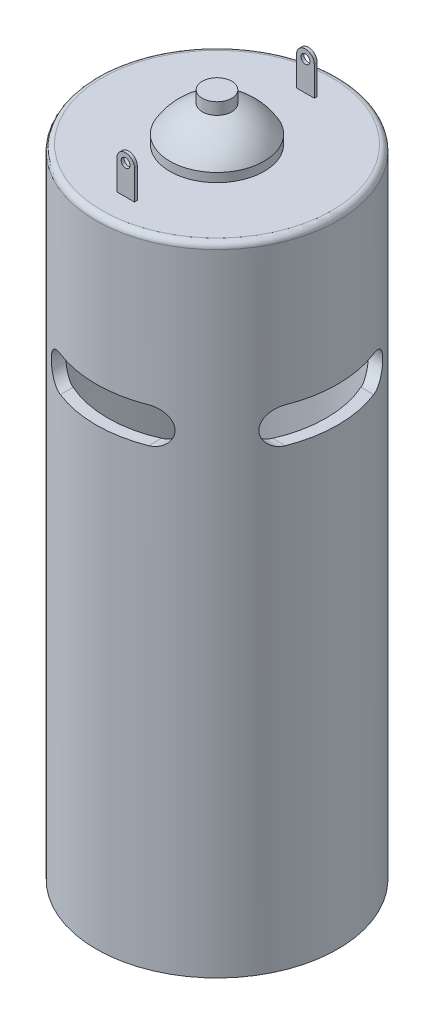
from build123d import *

# Parameters (mm, degrees)
SKETCH1_R               = 20.5
BOSS_EXTRUDE1_DEPTH     = 108
FILLET1_R               = 1
CUT_EXTRUDE1_REACH      = 130.166
CUT_EXTRUDE1_END_RADIUS = 18.5
CIRPATTERN1_COUNT       = 4
SKETCH7_R               = 0.75
BOSS_EXTRUDE2_DEPTH     = 0.5


# Read off the part's stored shape, not the designer's step: Shell1
with BuildPart() as part:
    # Sketch1 → Boss-Extrude1 (new body)
    with BuildSketch(Plane(origin=(0, 0, 0), x_dir=(1, 0, 0), z_dir=(0, 1, 0))):
        with Locations(Location((0, 0, 0), (0, 0, 270))):
            Circle(SKETCH1_R)
    extrude(amount=BOSS_EXTRUDE1_DEPTH)

    # Sketch3 → Revolve1 (revolve)
    with BuildSketch(Plane(origin=(0, 0, 0), x_dir=(0, 0, -1), z_dir=(1, 0, 0))):
        with BuildLine():
            Line((0, 116), (2.5, 116))
            Line((2.5, 116), (2.5, 114))
            ThreePointArc((2.5, 114), (5.663213274, 112.255038446), (8, 109.5))
            Line((8, 109.5), (8, 108))
            Line((8, 108), (0, 108))
            Line((0, 108), (0, 116))
        make_face()
    revolve(axis=Axis((0, 108, 0), (0, 1, 0)))

    # Fillet1
    fillet1_edges = [part.edges().sort_by_distance(p)[0] for p in [
        (0, 108, -20.5),
    ]]
    fillet(fillet1_edges, radius=FILLET1_R)

    # Shell1 outline → Shell1 (revolve, cut)
    with BuildSketch(Plane.XY):
        with BuildLine():
            Line((18.5, 0), (18.5, 106))
            Line((18.5, 106), (6, 106))
            Line((6, 106), (6, 108.933863711))
            ThreePointArc((6, 108.933863711), (3.622087212, 111.267143588), (0.5, 112.429570209))
            Line((0.5, 112.429570209), (0.5, 114))
            Line((0.5, 114), (0, 114))
            Line((0, 114), (0, 0))
            Line((0, 0), (18.5, 0))
        make_face()
    revolve(axis=Axis((0, 0, 0), (0, 1, 0)), mode=Mode.SUBTRACT)

    # Cut-Extrude1: up to this cylinder (the profile starts outside it)
    cut_extrude1_end = Plane(origin=(0, 80, 0), z_dir=(0, -1, 0)) * Cylinder(CUT_EXTRUDE1_END_RADIUS, 298.332, mode=Mode.PRIVATE)
    # Sketch4 → Cut-Extrude1 (cut, up to the surface)
    with BuildSketch(Plane(origin=(30, 0, 0), x_dir=(0, 0, -1), z_dir=(1, 0, 0)), mode=Mode.PRIVATE) as cut_extrude1_sk1:
        with BuildLine():
            Line((-7.5, 83), (7.5, 83))
            ThreePointArc((7.5, 83), (10.5, 80), (7.5, 77))
            Line((7.5, 77), (-7.5, 77))
            ThreePointArc((-7.5, 77), (-10.5, 80), (-7.5, 83))
        make_face()
    cut_extrude1_tool1 = extrude(cut_extrude1_sk1.sketch, amount=-CUT_EXTRUDE1_REACH, mode=Mode.PRIVATE) - cut_extrude1_end
    cut_extrude1 = cut_extrude1_tool1.solids().sort_by_distance((30, 80, 0))[0]
    add(cut_extrude1, mode=Mode.SUBTRACT)

    # CirPattern1: Cut-Extrude1 ×4 about axis
    cirpattern1_axis = Axis((0, 0, 0), (0, 1, 0))
    for i in range(1, CIRPATTERN1_COUNT):
        add(cut_extrude1.rotate(cirpattern1_axis, i * 360 / CIRPATTERN1_COUNT), mode=Mode.SUBTRACT)

    # Sketch7 → Boss-Extrude2 (add)
    with BuildSketch(Plane.XY.offset(15)):
        with BuildLine():
            Line((-1.5, 108), (1.5, 108))
            Line((1.5, 108), (1.5, 113))
            ThreePointArc((1.5, 113), (0, 114.5), (-1.5, 113))
            Line((-1.5, 113), (-1.5, 108))
        make_face()
        with Locations((0, 113)):
            Circle(SKETCH7_R, mode=Mode.SUBTRACT)
    boss_extrude2 = extrude(amount=BOSS_EXTRUDE2_DEPTH)

    # Mirror1: Boss-Extrude2 across plane
    add(boss_extrude2.mirror(Plane.XY))


solid = part.part
